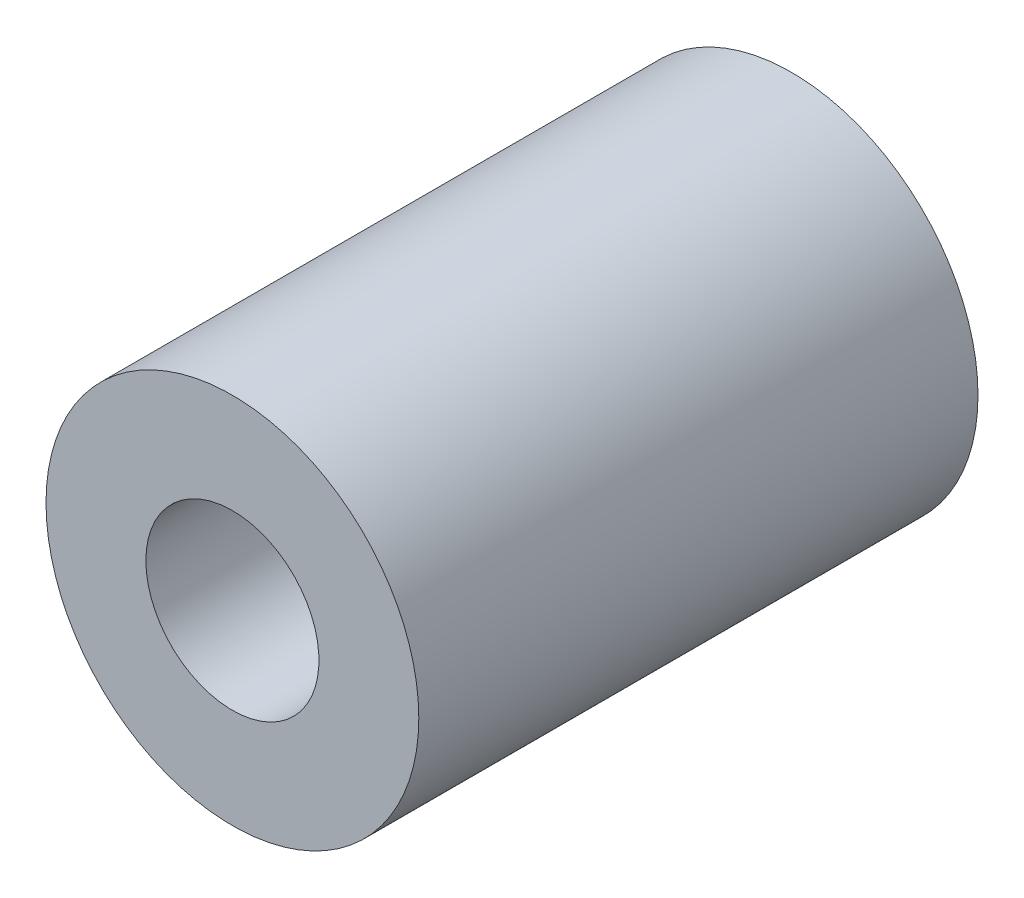
from build123d import *

# Parameters (mm, degrees)
ESQUISSE1_R        = 7
ESQUISSE1_R_2      = 3.25
BOSS_EXTRU_1_DEPTH = 21


with BuildPart() as part:
    # Esquisse1 → Boss.-Extru.1 (new body)
    with BuildSketch(Plane.XY):
        Circle(ESQUISSE1_R)
        Circle(ESQUISSE1_R_2, mode=Mode.SUBTRACT)
    extrude(amount=BOSS_EXTRU_1_DEPTH)


solid = part.part
